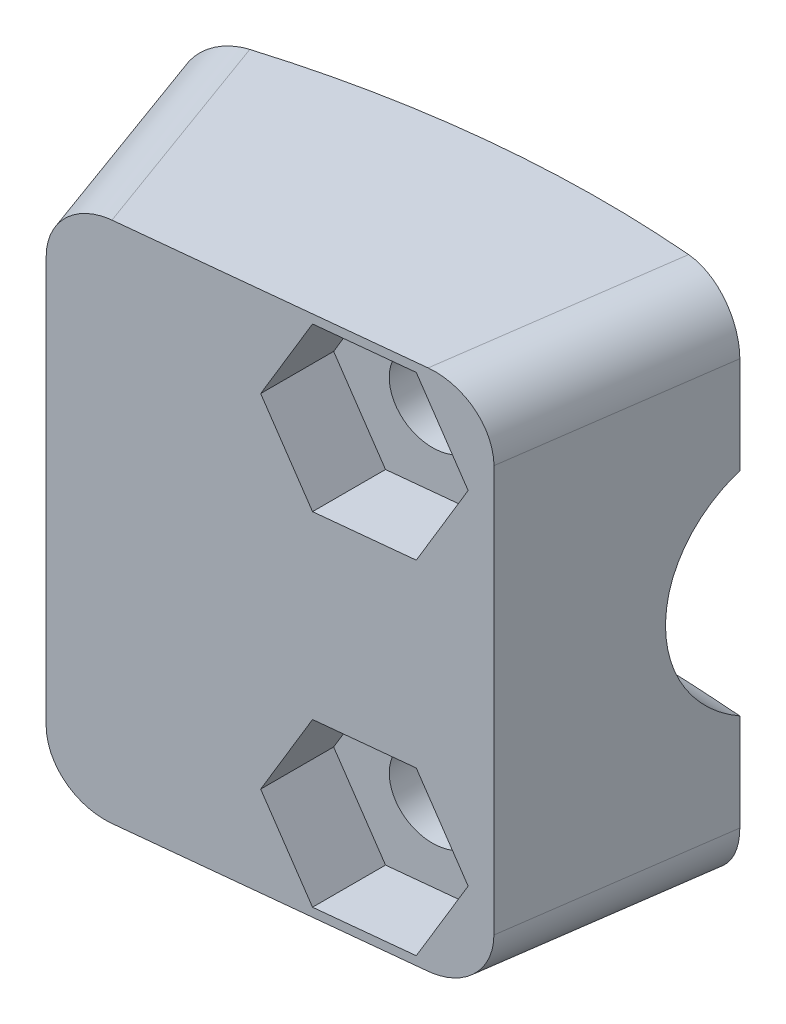
from build123d import *

# Parameters (mm, degrees)
BOSS_EXTRUDE1_DEPTH     = 18
CUT_EXTRUDE1_DEPTH      = 44.04814257
CUT_EXTRUDE1_DEPTH_BACK = 44.04814257
SKETCH5_R               = 1.5
CUT_EXTRUDE2_DEPTH      = 44.048142727
CUT_EXTRUDE3_START      = -18
CUT_EXTRUDE3_DEPTH      = 18
FILLET1_R               = 2
CUT_EXTRUDE5_REACH      = 44.569


# Read off the part's stored shape, not the designer's step: Cut-Extrude3
with BuildPart() as part:
    # Sketch2 → Boss-Extrude1 (new body)
    with BuildSketch(Plane(origin=(0, 0, 0), x_dir=(1, 0, 0), z_dir=(0, 1, 0))):
        with BuildLine():
            Line((5.149404736, 36.639918543), (4.036019928, 28.717773994))
            Line((4.036019928, 28.717773994), (-9.918584156, 27.251086003))
            Line((-9.918584156, 27.251086003), (-12.654745303, 34.768626969))
            ThreePointArc((-12.654745303, 34.768626969), (-3.867553141, 36.797310129), (5.149404736, 36.639918543))
        make_face()
    extrude(amount=BOSS_EXTRUDE1_DEPTH)

    # Sketch3 → Cut-Extrude1 (cut, two sides: drawn at the far end of the back side and taken through both)
    with BuildSketch(Plane(origin=(0, 0, 0), x_dir=(0, 0, -1), z_dir=(1, 0, 0)).offset(-CUT_EXTRUDE1_DEPTH_BACK)):
        with BuildLine():
            Line((38, 13.1), (41.639918543, 13.1))
            Line((41.639918543, 13.1), (41.639918543, 4.9))
            Line((41.639918543, 4.9), (38, 4.9))
            ThreePointArc((38, 4.9), (33.9, 9), (38, 13.1))
        make_face()
    extrude(amount=CUT_EXTRUDE1_DEPTH + CUT_EXTRUDE1_DEPTH_BACK, mode=Mode.SUBTRACT)

    # Sketch5 → Cut-Extrude2 (cut, through all)
    with BuildSketch(Plane.XY):
        with Locations(Location((0, 3.1, 0), (0, 0, 90))):
            Circle(SKETCH5_R)
        with Locations(Location((0, 14.9, 0), (0, 0, 90))):
            Circle(SKETCH5_R)
    extrude(amount=-CUT_EXTRUDE2_DEPTH, mode=Mode.SUBTRACT)

    # Cut-Extrude3 outline → Cut-Extrude3 (cut)
    with BuildSketch(Plane(origin=(0, 18, 0), x_dir=(1, 0, 0), z_dir=(0, 1, 0)).offset(CUT_EXTRUDE3_START)):
        with BuildLine():
            ThreePointArc((-12.483737701, 34.29877976), (-3.815290216, 36.300049044), (5.079818185, 36.144784509))
            Line((5.079818185, 36.144784509), (5.149404736, 36.639918543))
            ThreePointArc((5.149404736, 36.639918543), (-3.867553141, 36.797310129), (-12.654745303, 34.768626969))
            Line((-12.654745303, 34.768626969), (-12.483737701, 34.29877976))
        make_face()
    extrude(amount=CUT_EXTRUDE3_DEPTH, mode=Mode.SUBTRACT)

    # Fillet1
    fillet1_edges = [part.edges().sort_by_distance(p)[0] for p in [
        (4.557919056, 18, -32.431279251),
        (4.557919056, 0, -32.431279251),
        (-11.201159694, 0, -30.774933331),
        (-11.201159694, 18, -30.774933331),
    ]]
    fillet(fillet1_edges, radius=FILLET1_R)

    # Cut-Extrude5: up to this plane
    cut_extrude5_end = Plane(origin=(-10.179905315, 18, -29.737390741), z_dir=(-0.10452846326765396, 0, -0.9945218953682733))
    # Sketch7 → Cut-Extrude5 (cut, up to the surface)
    with BuildSketch(Plane.XY, mode=Mode.PRIVATE) as cut_extrude5_sk1:
        Polygon((3.233161507, 14.9), (1.616580754, 17.7), (-1.616580754, 17.7), (-3.233161507, 14.9), (-1.616580754, 12.1), (1.616580754, 12.1), align=None)
    cut_extrude5_tool1 = split(extrude(cut_extrude5_sk1.sketch, amount=-CUT_EXTRUDE5_REACH, mode=Mode.PRIVATE), bisect_by=cut_extrude5_end, keep=Keep.BOTH, mode=Mode.PRIVATE)
    add(cut_extrude5_tool1.solids().sort_by_distance((0, 14.9, 0))[0], mode=Mode.SUBTRACT)
    # Sketch7 → Cut-Extrude5 (cut, up to the surface)
    with BuildSketch(Plane.XY, mode=Mode.PRIVATE) as cut_extrude5_sk2:
        Polygon((-3.233161507, 3.1), (-1.616580754, 0.3), (1.616580754, 0.3), (3.233161507, 3.1), (1.616580754, 5.9), (-1.616580754, 5.9), align=None)
    cut_extrude5_tool2 = split(extrude(cut_extrude5_sk2.sketch, amount=-CUT_EXTRUDE5_REACH, mode=Mode.PRIVATE), bisect_by=cut_extrude5_end, keep=Keep.BOTH, mode=Mode.PRIVATE)
    add(cut_extrude5_tool2.solids().sort_by_distance((0, 3.1, 0))[0], mode=Mode.SUBTRACT)


solid = part.part
